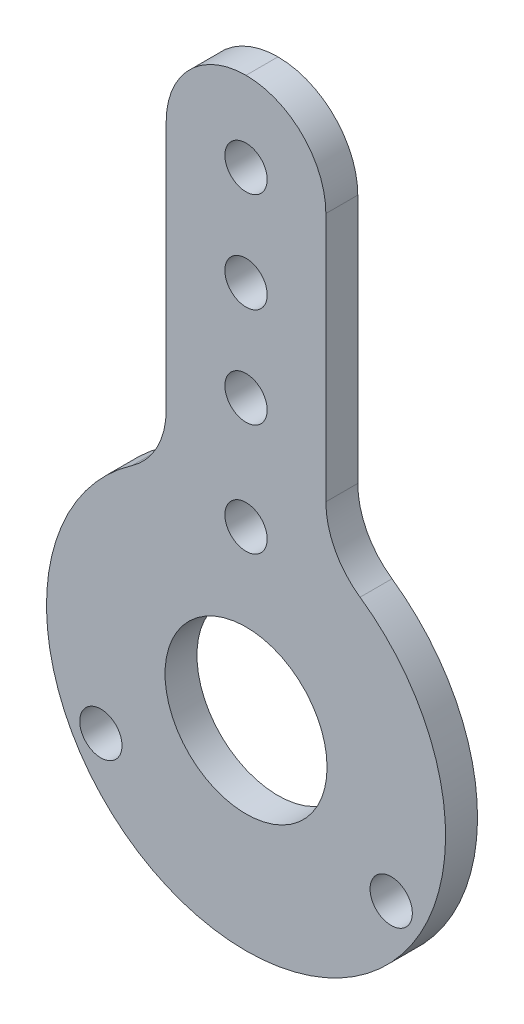
from build123d import *

# Parameters (mm, degrees)
SKETCH_1_R      = 10.15
SKETCH_1_R_2    = 2.65
EXTRUDE_1_DEPTH = 4
FILLET_1_R      = 10


with BuildPart() as part:
    # 草图1 → 凸台-拉伸1 (new body)
    with BuildSketch(Plane.XY):
        with BuildLine():
            Line((-10, 70), (-10, 22.912878475))
            ThreePointArc((-10, 22.912878475), (0, -25), (10, 22.912878475))
            Line((10, 22.912878475), (10, 70))
            Line((10, 70), (-10, 70))
        make_face()
        Circle(SKETCH_1_R, mode=Mode.SUBTRACT)
        with Locations((0, 21)):
            Circle(SKETCH_1_R_2, mode=Mode.SUBTRACT)
        with Locations((18.186533479, -10.5)):
            Circle(SKETCH_1_R_2, mode=Mode.SUBTRACT)
        with Locations((-18.186533479, -10.5)):
            Circle(SKETCH_1_R_2, mode=Mode.SUBTRACT)
        with Locations((0, 60)):
            Circle(SKETCH_1_R_2, mode=Mode.SUBTRACT)
        with Locations((0, 35)):
            Circle(SKETCH_1_R_2, mode=Mode.SUBTRACT)
        with Locations((0, 47.5)):
            Circle(SKETCH_1_R_2, mode=Mode.SUBTRACT)
    extrude(amount=EXTRUDE_1_DEPTH)

    # 圆角1
    fillet_1_edges = [part.edges().sort_by_distance(p)[0] for p in [
        (10, 22.912878475, 2),
        (10, 70, 2),
        (-10, 70, 2),
        (-10, 22.912878475, 2),
    ]]
    fillet(fillet_1_edges, radius=FILLET_1_R - 0.0001)  # a hair under: the kernel refuses the full size


solid = part.part
